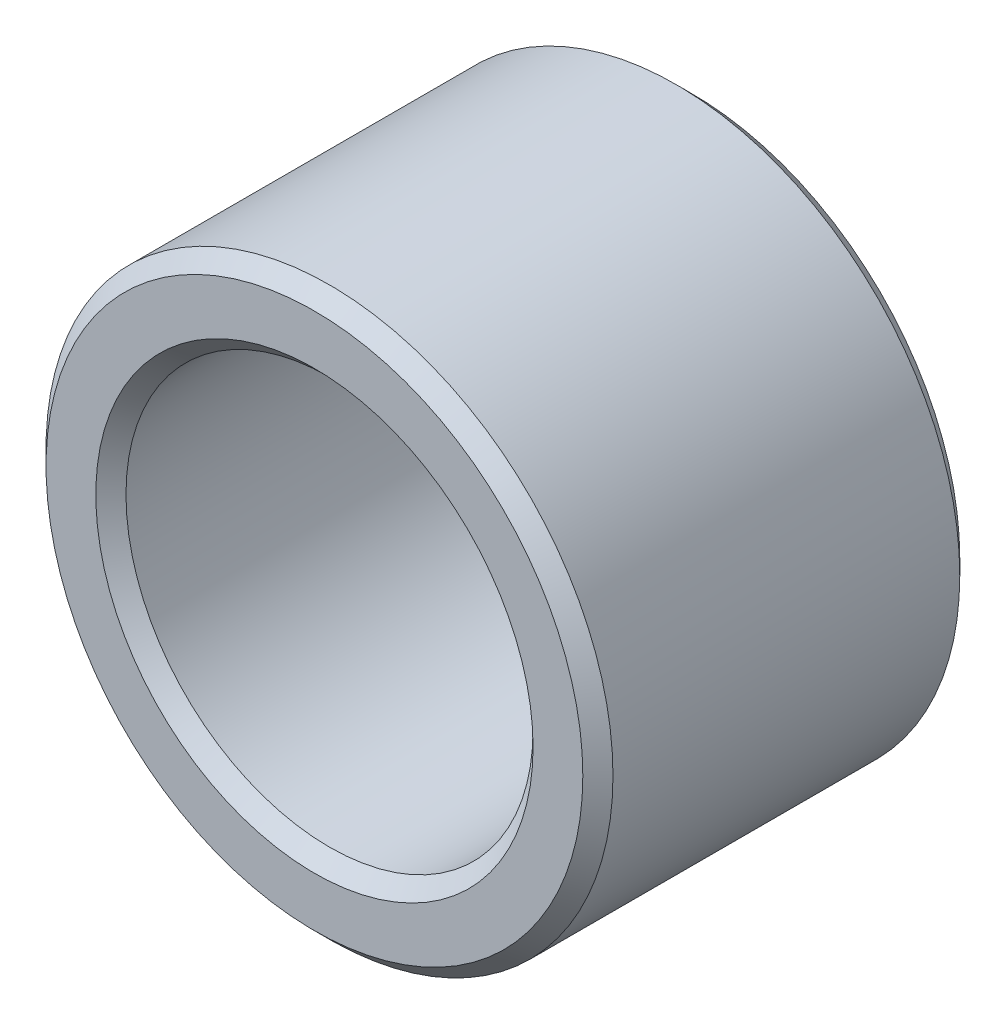
from build123d import *

# Parameters (mm, degrees)
SKETCH1_R      = 4.7752
SKETCH1_R_2    = 3.429
EXTRUDE1_DEPTH = 3.175
CHAMFER1_SIZE  = 0.254


with BuildPart() as part:
    # Sketch1 → Extrude1 (new, symmetric)
    with BuildSketch(Plane.XY):
        Circle(SKETCH1_R)
        Circle(SKETCH1_R_2, mode=Mode.SUBTRACT)
    extrude(amount=EXTRUDE1_DEPTH, both=True)

    # Chamfer1
    chamfer1_edges = [part.edges().sort_by_distance(p)[0] for p in [
        (-3.429, 0, -3.175),
        (-4.7752, 0, -3.175),
        (-3.429, 0, 3.175),
        (-4.7752, 0, 3.175),
    ]]
    chamfer(chamfer1_edges, length=CHAMFER1_SIZE)


solid = part.part
